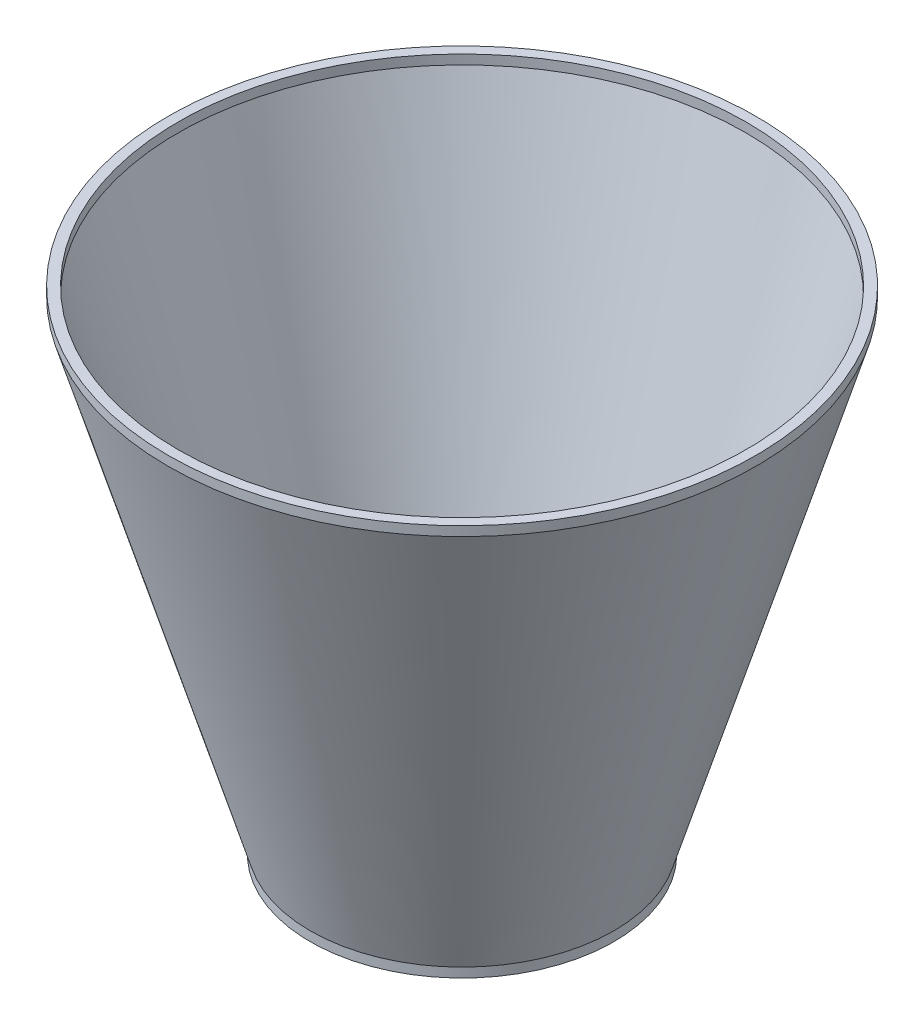
from build123d import *

# Parameters (mm, degrees)
SKETCH2_R           = 32.088061302
SKETCH2_R_2         = 30
BOSS_EXTRUDE1_DEPTH = 2
SKETCH3_R           = 62.088061302
SKETCH3_R_2         = 60
BOSS_EXTRUDE2_DEPTH = 2


with BuildPart() as part:
    # Sketch1 → Revolve1 (revolve)
    with BuildSketch(Plane.XY):
        Polygon((-30, 0), (-60, 100), (-62.088061302, 100), (-32.088061302, 0), align=None)
    revolve(axis=Axis((0, 0, 0), (0, 1, 0)))

    # Sketch2 → Boss-Extrude1 (add)
    with BuildSketch(Plane.XZ):
        Circle(SKETCH2_R)
        Circle(SKETCH2_R_2, mode=Mode.SUBTRACT)
    extrude(amount=BOSS_EXTRUDE1_DEPTH)

    # Sketch3 → Boss-Extrude2 (add)
    with BuildSketch(Plane(origin=(0, 100, 0), x_dir=(1, 0, 0), z_dir=(0, 1, 0))):
        Circle(SKETCH3_R)
        Circle(SKETCH3_R_2, mode=Mode.SUBTRACT)
    extrude(amount=BOSS_EXTRUDE2_DEPTH)


solid = part.part
